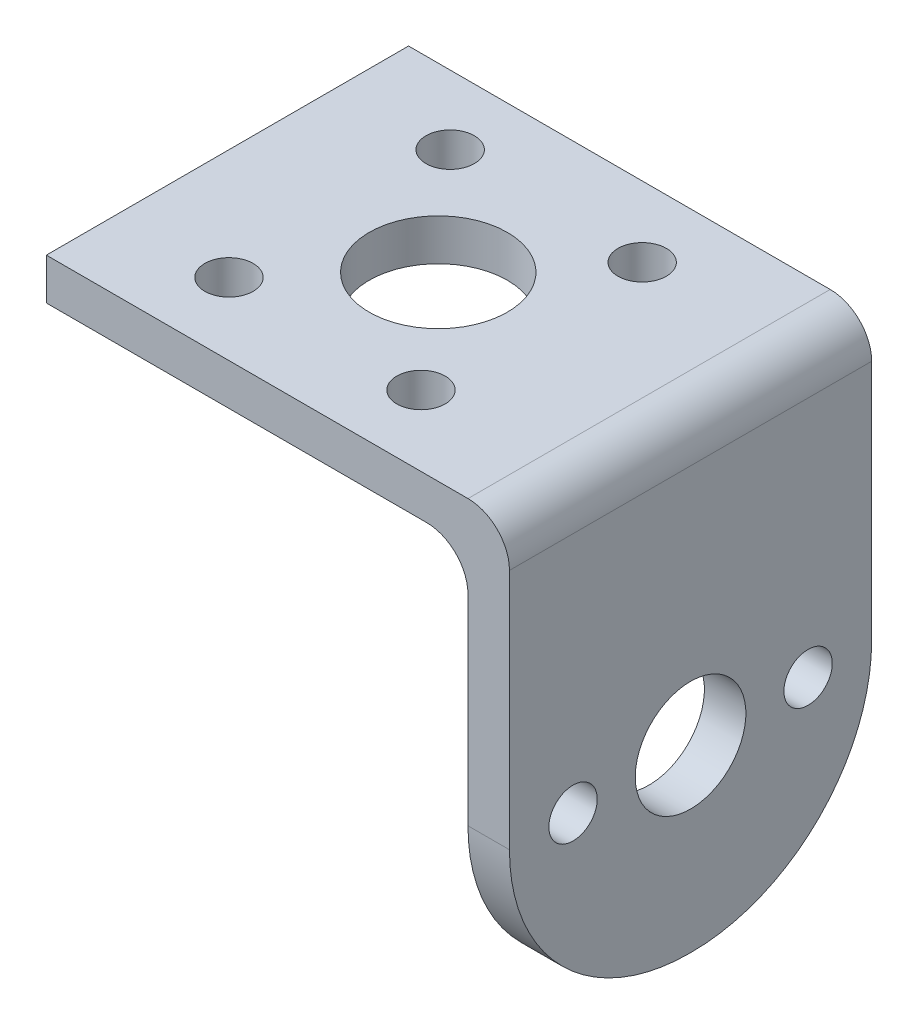
from build123d import *

# Parameters (mm, degrees)
SKETCH1_W               = 33.5
SKETCH1_H               = 26.2
BOSS_EXTRUDE1_DEPTH     = 3
SKETCH3_W               = 3
SKETCH3_H               = 26.2
BOSS_EXTRUDE3_DEPTH     = 30.5
FILLET1_R               = 13
SKETCH7_R               = 1.75
SKETCH7_R_2             = 5
CUT_EXTRUDE1_DEPTH      = 53.334883204
FILLET2_R               = 3
CUT_EXTRUDE2_DEPTH      = 53.334883204
CUT_EXTRUDE2_DEPTH_BACK = 3.5
SKETCH10_R              = 1.75
SKETCH10_R_2            = 4


with BuildPart() as part:
    # Sketch1 → Boss-Extrude1 (new body)
    with BuildSketch(Plane(origin=(0, 0, 0), x_dir=(1, 0, 0), z_dir=(0, 1, 0))):
        with Locations((16.75, 13.1)):
            Rectangle(SKETCH1_W, SKETCH1_H)
    extrude(amount=BOSS_EXTRUDE1_DEPTH)

    # Sketch3 → Boss-Extrude3 (add)
    with BuildSketch(Plane.XZ):
        with Locations((32, -13.1)):
            Rectangle(SKETCH3_W, SKETCH3_H)
    extrude(amount=BOSS_EXTRUDE3_DEPTH)

    # Fillet1
    fillet1_edges = [part.edges().sort_by_distance(p)[0] for p in [
        (32, -30.5, 0),
        (32, -30.5, -26.2),
    ]]
    fillet(fillet1_edges, radius=FILLET1_R)

    # Sketch7 → Cut-Extrude1 (cut, through all)
    with BuildSketch(Plane.XZ):
        with Locations((8, -5.211347336)):
            Circle(SKETCH7_R)
        with Locations((8, -21.211347336)):
            Circle(SKETCH7_R)
        with Locations((22, -21.1)):
            Circle(SKETCH7_R)
        with Locations((22, -5.1)):
            Circle(SKETCH7_R)
        with Locations((15.25, -13.1)):
            Circle(SKETCH7_R_2)
    extrude(amount=-CUT_EXTRUDE1_DEPTH, mode=Mode.SUBTRACT)

    # Fillet2
    fillet2_edges = [part.edges().sort_by_distance(p)[0] for p in [
        (30.5, 0, -13.1),
        (33.5, 3, -13.1),
    ]]
    fillet(fillet2_edges, radius=FILLET2_R)

    # Sketch10 → Cut-Extrude2 (cut, two sides: drawn at the far end of the back side and taken through both)
    with BuildSketch(Plane(origin=(33.5, 0, 0), x_dir=(0, 0, -1), z_dir=(1, 0, 0)).offset(-CUT_EXTRUDE2_DEPTH_BACK)):
        with Locations((4.6, -17.5)):
            Circle(SKETCH10_R)
        with Locations((21.6, -17.5)):
            Circle(SKETCH10_R)
        with Locations((13.1, -17.5)):
            Circle(SKETCH10_R_2)
    extrude(amount=CUT_EXTRUDE2_DEPTH + CUT_EXTRUDE2_DEPTH_BACK, mode=Mode.SUBTRACT)


solid = part.part
